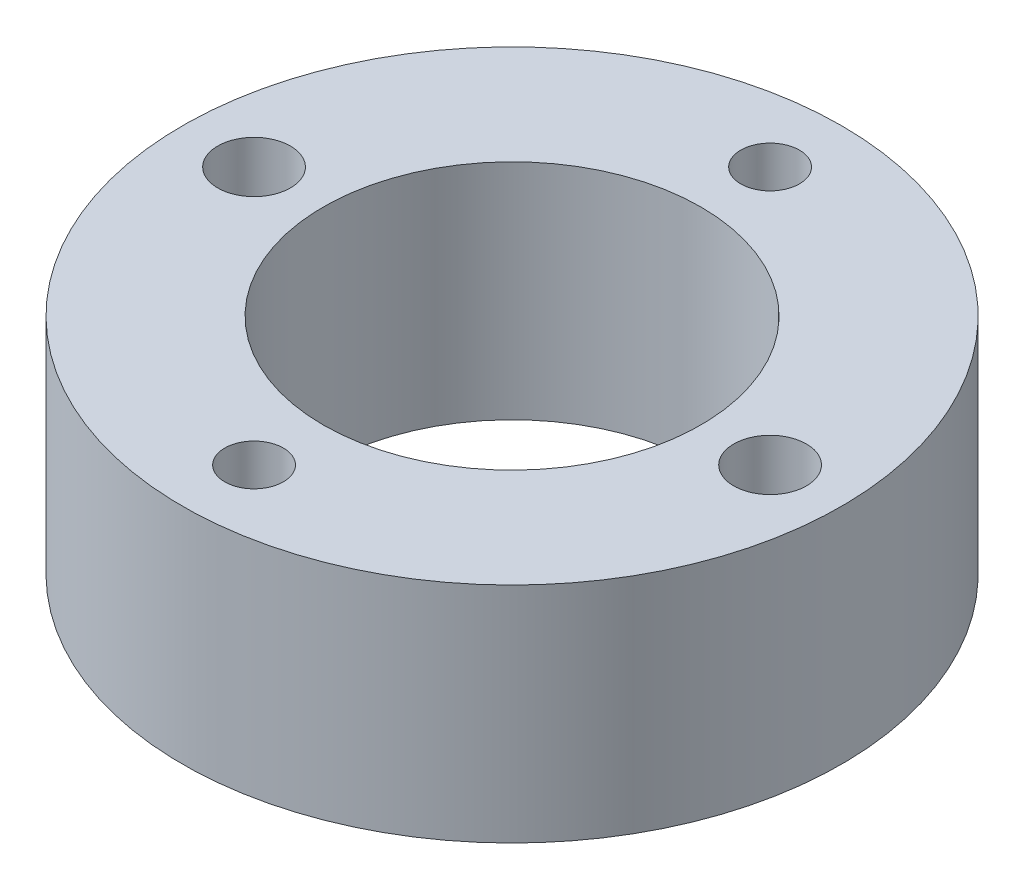
from build123d import *

# Parameters (mm, degrees)
SKETCH1_R           = 14.05
SKETCH1_R_2         = 8.05
SKETCH1_R_3         = 1.55
SKETCH1_R_4         = 1.25
BOSS_EXTRUDE1_DEPTH = 9.525


with BuildPart() as part:
    # Sketch1 → Boss-Extrude1 (new body)
    with BuildSketch(Plane(origin=(0, 0, 0), x_dir=(1, 0, 0), z_dir=(0, 1, 0))):
        Circle(SKETCH1_R)
        Circle(SKETCH1_R_2, mode=Mode.SUBTRACT)
        with Locations((11, 0)):
            Circle(SKETCH1_R_3, mode=Mode.SUBTRACT)
        with Locations((-11, 0)):
            Circle(SKETCH1_R_3, mode=Mode.SUBTRACT)
        with Locations((0, 11)):
            Circle(SKETCH1_R_4, mode=Mode.SUBTRACT)
        with Locations((0, -11)):
            Circle(SKETCH1_R_4, mode=Mode.SUBTRACT)
    extrude(amount=BOSS_EXTRUDE1_DEPTH)


solid = part.part
